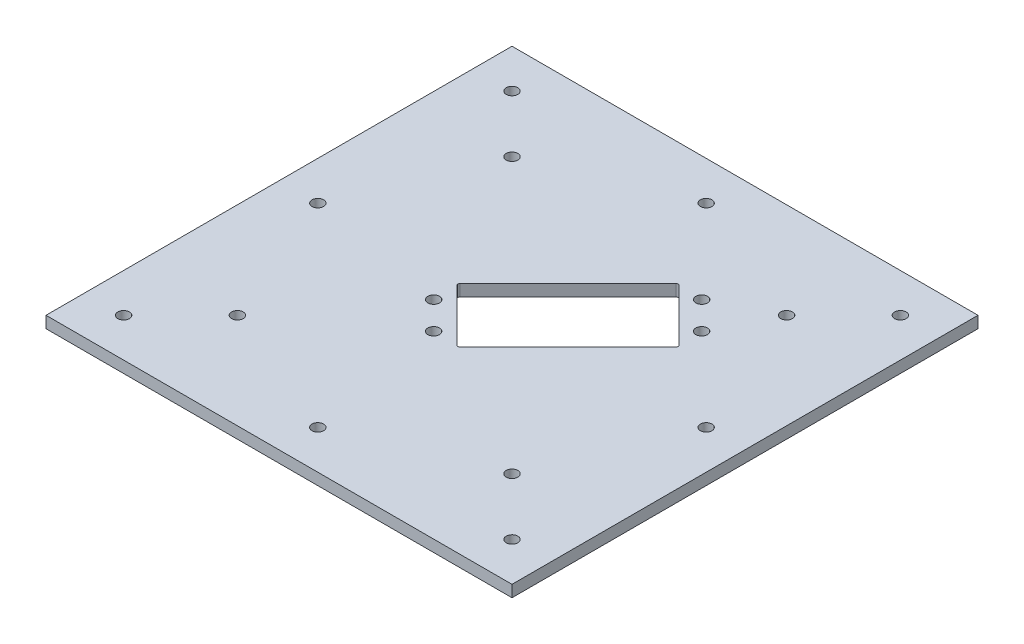
from build123d import *

# Parameters (mm, degrees)
SKETCH1_W           = 120
SKETCH1_H           = 120
BOSS_EXTRUDE1_DEPTH = 3
CAVITY1_DEPTH       = 3
SKETCH5_R           = 1.5
CUT_EXTRUDE3_DEPTH  = 3
SKETCH6_R           = 1.5
CUT_EXTRUDE4_DEPTH  = 3
SKETCH8_R           = 1.5
CUT_EXTRUDE6_DEPTH  = 3


# Read off the part's stored shape, not the designer's step: Cavity1
with BuildPart() as part:
    # Sketch1 → Boss-Extrude1 (new body)
    with BuildSketch(Plane(origin=(0, 0, 0), x_dir=(1, 0, 0), z_dir=(0, 1, 0))):
        with Locations((60, -60)):
            Rectangle(SKETCH1_W, SKETCH1_H)
    extrude(amount=BOSS_EXTRUDE1_DEPTH)

    # Cavity1 outline → Cavity1 (cut)
    with BuildSketch(Plane(origin=(0, 0, 0), x_dir=(1, 0, 0), z_dir=(0, 1, 0))):
        with BuildLine():
            Line((46.211417874, -60.353557562), (59.646450781, -73.78858234))
            ThreePointArc((59.646450781, -73.78858234), (60.000004216, -73.935028843), (60.353557562, -73.788582126))
            Line((60.353557562, -73.788582126), (88.213556312, -45.928566518))
            ThreePointArc((88.213556312, -45.928566518), (88.360002815, -45.575013083), (88.213556098, -45.221459737))
            Line((88.213556098, -45.221459737), (74.778523191, -31.786434959))
            ThreePointArc((74.778523191, -31.786434959), (74.424969756, -31.639988457), (74.07141641, -31.786435173))
            Line((74.07141641, -31.786435173), (46.21141766, -59.646450781))
            ThreePointArc((46.21141766, -59.646450781), (46.064971157, -60.000004216), (46.211417874, -60.353557562))
        make_face()
    extrude(amount=CAVITY1_DEPTH, mode=Mode.SUBTRACT)

    # Sketch5 → Cut-Extrude3 (cut)
    with BuildSketch(Plane(origin=(0, 3, 0), x_dir=(1, 0, 0), z_dir=(0, 1, 0))):
        with Locations(Location((60, -10, 0), (0, 0, 270))):
            Circle(SKETCH5_R)
        with Locations(Location((95.355339059, -24.644660941, 0), (0, 0, 270))):
            Circle(SKETCH5_R)
        with Locations(Location((110, -60, 0), (0, 0, 270))):
            Circle(SKETCH5_R)
        with Locations(Location((95.355339059, -95.355339059, 0), (0, 0, 270))):
            Circle(SKETCH5_R)
        with Locations(Location((60, -110, 0), (0, 0, 270))):
            Circle(SKETCH5_R)
        with Locations(Location((24.644660941, -95.355339059, 0), (0, 0, 270))):
            Circle(SKETCH5_R)
        with Locations(Location((10, -60, 0), (0, 0, 270))):
            Circle(SKETCH5_R)
        with Locations(Location((24.644660941, -24.644660941, 0), (0, 0, 270))):
            Circle(SKETCH5_R)
    extrude(amount=-CUT_EXTRUDE3_DEPTH, mode=Mode.SUBTRACT)

    # Sketch6 → Cut-Extrude4 (cut)
    with BuildSketch(Plane(origin=(0, 3, 0), x_dir=(1, 0, 0), z_dir=(0, 1, 0))):
        with Locations(Location((10, -10, 0), (0, 0, 270))):
            Circle(SKETCH6_R)
        with Locations(Location((110, -10, 0), (0, 0, 270))):
            Circle(SKETCH6_R)
        with Locations(Location((110, -110, 0), (0, 0, 270))):
            Circle(SKETCH6_R)
        with Locations(Location((10, -110, 0), (0, 0, 270))):
            Circle(SKETCH6_R)
    extrude(amount=-CUT_EXTRUDE4_DEPTH, mode=Mode.SUBTRACT)

    # Sketch8 → Cut-Extrude6 (cut)
    with BuildSketch(Plane(origin=(0, 3, 0), x_dir=(1, 0, 0), z_dir=(0, 1, 0))):
        with Locations(Location((87.994675608, -39.154311265, 0), (0, 0, 270))):
            Circle(SKETCH8_R)
        with Locations(Location((80.923607796, -32.083243453, 0), (0, 0, 270))):
            Circle(SKETCH8_R)
        with Locations(Location((46.416796874, -66.590054375, 0), (0, 0, 270))):
            Circle(SKETCH8_R)
        with Locations(Location((53.487864686, -73.661122187, 0), (0, 0, 270))):
            Circle(SKETCH8_R)
    extrude(amount=-CUT_EXTRUDE6_DEPTH, mode=Mode.SUBTRACT)


solid = part.part
